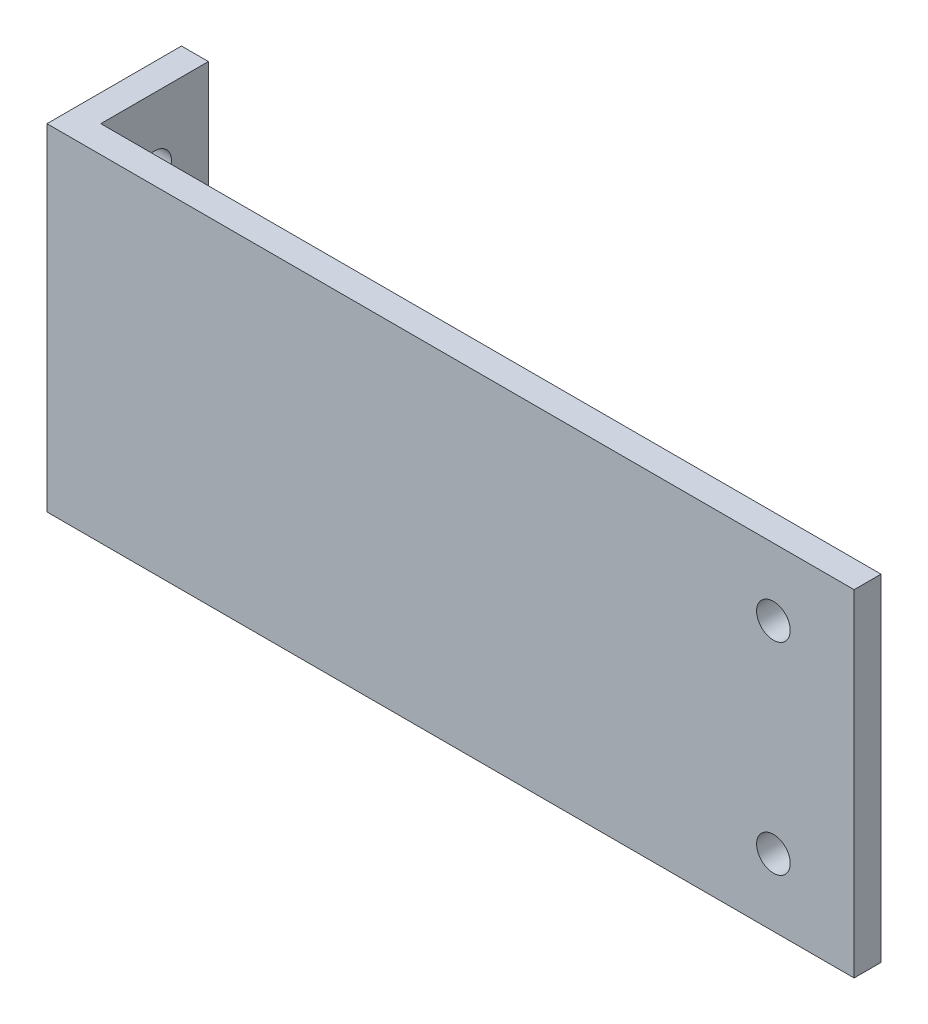
from build123d import *

# Parameters (mm, degrees)
EXTRUDE_1_DEPTH     = 50
SKETCH_2_R          = 2.5
CUT_EXTRUDE_1_DEPTH = 10
SKETCH_3_R          = 2.5
CUT_EXTRUDE_2_DEPTH = 10


with BuildPart() as part:
    # Эскиз1 → Бобышка-Вытянуть1 (new body)
    with BuildSketch(Plane(origin=(0, 0, 0), x_dir=(1, 0, 0), z_dir=(0, 1, 0))):
        Polygon((0, 0), (120, 0), (120, 4), (4, 4), (4, 20), (0, 20), (0, 4), align=None)
    extrude(amount=EXTRUDE_1_DEPTH)

    # Эскиз2 → Вырез-Вытянуть1 (cut)
    with BuildSketch(Plane.ZY):
        with Locations((-12, 40)):
            Circle(SKETCH_2_R)
        with Locations((-12, 10)):
            Circle(SKETCH_2_R)
    extrude(amount=-CUT_EXTRUDE_1_DEPTH, mode=Mode.SUBTRACT)

    # Эскиз3 → Вырез-Вытянуть2 (cut)
    with BuildSketch(Plane.XY):
        with Locations((108, 40)):
            Circle(SKETCH_3_R)
        with Locations((108, 10)):
            Circle(SKETCH_3_R)
    extrude(amount=-CUT_EXTRUDE_2_DEPTH, mode=Mode.SUBTRACT)


solid = part.part
